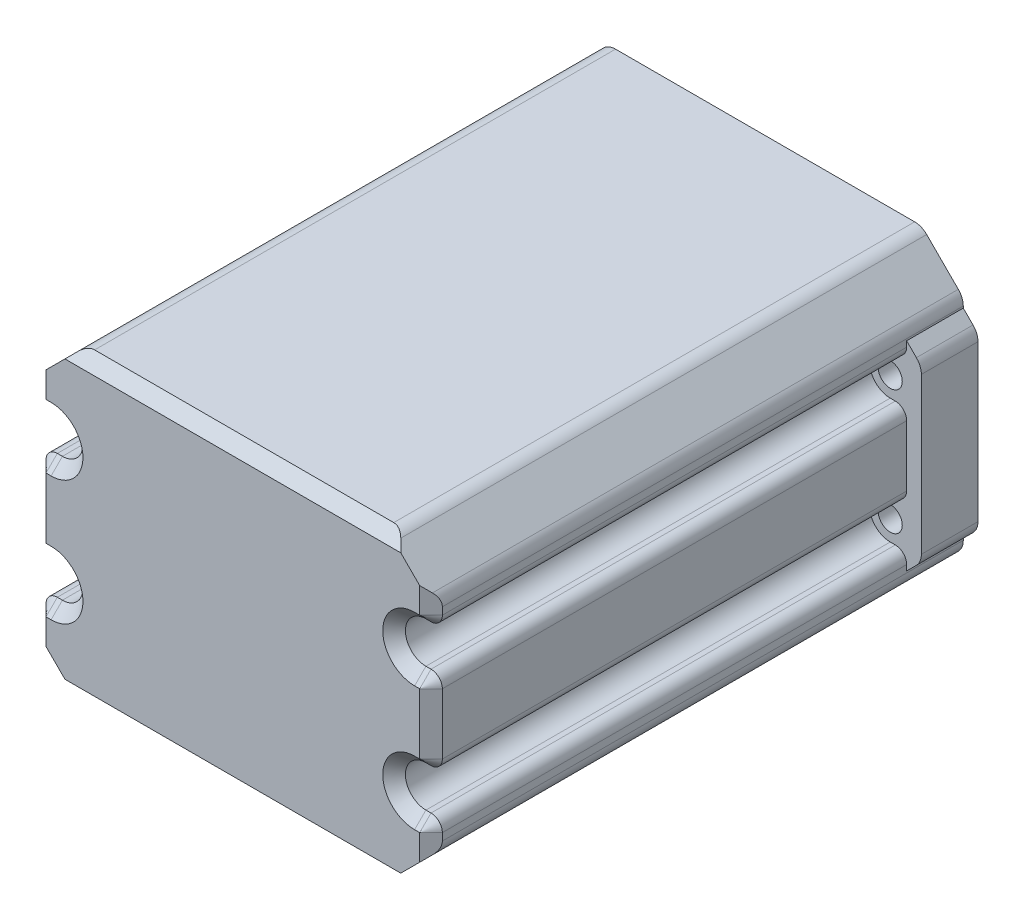
from build123d import *

# Parameters (mm, degrees)
BOSS_EXTRUDE1_DEPTH = 90
SKETCH1_3_R         = 2.125
BOSS_EXTRUDE2_DEPTH = 10
FILLET1_R           = 2
BOSS_EXTRUDE3_START = 4
BOSS_EXTRUDE3_DEPTH = 4
CHAMFER1_SIZE       = 2
FILLET3_R           = 3


with BuildPart() as part:
    # Sketch1 → Boss-Extrude1 (new body)
    with BuildSketch(Plane.XY):
        with BuildLine():
            Line((55.313708499, 53), (0, 53))
            Line((0, 53), (-7.343145751, 45.656854249))
            Line((-7.343145751, 45.656854249), (-7.343145751, 41.125))
            Line((-7.343145751, 41.125), (-4.443145751, 41.125))
            ThreePointArc((-4.443145751, 41.125), (-0.818145751, 37.5), (-4.443145751, 33.875))
            Line((-4.443145751, 33.875), (-7.343145751, 33.875))
            Line((-7.343145751, 33.875), (-7.343145751, 19.125))
            Line((-7.343145751, 19.125), (-4.443145751, 19.125))
            ThreePointArc((-4.443145751, 19.125), (-0.818145751, 15.5), (-4.443145751, 11.875))
            Line((-4.443145751, 11.875), (-7.343145751, 11.875))
            Line((-7.343145751, 11.875), (-7.343145751, 7.343145751))
            Line((-7.343145751, 7.343145751), (0, 0))
            Line((0, 0), (55.313708499, 0))
            Line((55.313708499, 0), (62.656854249, 7.343145751))
            Line((62.656854249, 7.343145751), (62.656854249, 11.875))
            Line((62.656854249, 11.875), (59.756854249, 11.875))
            ThreePointArc((59.756854249, 11.875), (56.131854249, 15.5), (59.756854249, 19.125))
            Line((59.756854249, 19.125), (62.656854249, 19.125))
            Line((62.656854249, 19.125), (62.656854249, 33.875))
            Line((62.656854249, 33.875), (59.756854249, 33.875))
            ThreePointArc((59.756854249, 33.875), (56.131854249, 37.5), (59.756854249, 41.125))
            Line((59.756854249, 41.125), (62.656854249, 41.125))
            Line((62.656854249, 41.125), (62.656854249, 45.656854249))
            Line((62.656854249, 45.656854249), (55.313708499, 53))
        make_face()
        with BuildLine():
            Line((53.656854249, 4), (1.656854249, 4))
            Line((1.656854249, 4), (-3.343145751, 9))
            Line((-3.343145751, 9), (-3.343145751, 9.601695159))
            ThreePointArc((-3.343145751, 9.601695159), (0.172046553, 11.665942097), (1.556854249, 15.5))
            Line((1.556854249, 15.5), (1.556854249, 37.5))
            ThreePointArc((1.556854249, 37.5), (0.172046553, 41.334057903), (-3.343145751, 43.398304841))
            Line((-3.343145751, 43.398304841), (-3.343145751, 44))
            Line((-3.343145751, 44), (1.656854249, 49))
            Line((1.656854249, 49), (53.656854249, 49))
            Line((53.656854249, 49), (58.656854249, 44))
            Line((58.656854249, 44), (58.656854249, 43.398304841))
            ThreePointArc((58.656854249, 43.398304841), (55.141661946, 41.334057903), (53.756854249, 37.5))
            Line((53.756854249, 37.5), (53.756854249, 15.5))
            ThreePointArc((53.756854249, 15.5), (55.141661946, 11.665942097), (58.656854249, 9.601695159))
            Line((58.656854249, 9.601695159), (58.656854249, 9))
            Line((58.656854249, 9), (53.656854249, 4))
        make_face(mode=Mode.SUBTRACT)
    extrude(amount=BOSS_EXTRUDE1_DEPTH)

    # Sketch1<3> → Boss-Extrude2 (add)
    # profile 1 of 2: a face of its own
    with BuildSketch(Plane.XY):
        with BuildLine():
            ThreePointArc((-4.443145751, 33.875), (-0.818145751, 37.5), (-4.443145751, 41.125))
            Line((-4.443145751, 41.125), (-7.343145751, 41.125))
            Line((-7.343145751, 41.125), (-7.343145751, 44.1))
            Line((-7.343145751, 44.1), (-9.943145751, 41.5))
            Line((-9.943145751, 41.5), (-9.943145751, 11.5))
            Line((-9.943145751, 11.5), (-7.343145751, 8.9))
            Line((-7.343145751, 8.9), (-7.343145751, 11.875))
            Line((-7.343145751, 11.875), (-4.443145751, 11.875))
            ThreePointArc((-4.443145751, 11.875), (-0.818145751, 15.5), (-4.443145751, 19.125))
            Line((-4.443145751, 19.125), (-7.343145751, 19.125))
            Line((-7.343145751, 19.125), (-7.343145751, 33.875))
            Line((-7.343145751, 33.875), (-4.443145751, 33.875))
        make_face()
        with Locations((-4.443145751, 15.5)):
            Circle(SKETCH1_3_R, mode=Mode.SUBTRACT)
        with Locations((-4.443145751, 37.5)):
            Circle(SKETCH1_3_R, mode=Mode.SUBTRACT)
    # profile 2 of 2: a face of its own
    with BuildSketch(Plane.XY):
        with BuildLine():
            Line((65.256854249, 41.5), (62.656854249, 44.1))
            Line((62.656854249, 44.1), (62.656854249, 41.125))
            Line((62.656854249, 41.125), (59.756854249, 41.125))
            ThreePointArc((59.756854249, 41.125), (56.131854249, 37.5), (59.756854249, 33.875))
            Line((59.756854249, 33.875), (62.656854249, 33.875))
            Line((62.656854249, 33.875), (62.656854249, 19.125))
            Line((62.656854249, 19.125), (59.756854249, 19.125))
            ThreePointArc((59.756854249, 19.125), (56.131854249, 15.5), (59.756854249, 11.875))
            Line((59.756854249, 11.875), (62.656854249, 11.875))
            Line((62.656854249, 11.875), (62.656854249, 8.9))
            Line((62.656854249, 8.9), (65.256854249, 11.5))
            Line((65.256854249, 11.5), (65.256854249, 41.5))
        make_face()
        with Locations((59.756854249, 37.5)):
            Circle(SKETCH1_3_R, mode=Mode.SUBTRACT)
        with Locations((59.756854249, 15.5)):
            Circle(SKETCH1_3_R, mode=Mode.SUBTRACT)
    extrude(amount=BOSS_EXTRUDE2_DEPTH)

    # Fillet1
    fillet1_edges = [part.edges().sort_by_distance(p)[0] for p in [
        (62.656854249, 41.125, 50),
        (62.656854249, 33.875, 50),
        (62.656854249, 19.125, 50),
        (62.656854249, 11.875, 50),
        (-7.343145751, 11.875, 50),
        (-7.343145751, 19.125, 50),
        (-7.343145751, 33.875, 50),
        (-7.343145751, 41.125, 50),
    ]]
    fillet(fillet1_edges, radius=FILLET1_R)

    # Sketch2 → Boss-Extrude3 (add)
    with BuildSketch(Plane.XY.offset(90).offset(BOSS_EXTRUDE3_START)):
        with BuildLine():
            Line((-7.343145751, 31.875), (-7.343145751, 21.125))
            ThreePointArc((-7.343145751, 21.125), (-6.757359313, 19.710786438), (-5.343145751, 19.125))
            Line((-5.343145751, 19.125), (-4.443145751, 19.125))
            ThreePointArc((-4.443145751, 19.125), (-0.818145751, 15.5), (-4.443145751, 11.875))
            Line((-4.443145751, 11.875), (-5.343145751, 11.875))
            ThreePointArc((-5.343145751, 11.875), (-6.757359313, 11.289213562), (-7.343145751, 9.875))
            Line((-7.343145751, 9.875), (-7.343145751, 7.343145751))
            Line((-7.343145751, 7.343145751), (0, 0))
            Line((0, 0), (55.313708499, 0))
            Line((55.313708499, 0), (62.656854249, 7.343145751))
            Line((62.656854249, 7.343145751), (62.656854249, 9.875))
            ThreePointArc((62.656854249, 9.875), (62.071067812, 11.289213562), (60.656854249, 11.875))
            Line((60.656854249, 11.875), (59.756854249, 11.875))
            ThreePointArc((59.756854249, 11.875), (56.131854249, 15.5), (59.756854249, 19.125))
            Line((59.756854249, 19.125), (60.656854249, 19.125))
            ThreePointArc((60.656854249, 19.125), (62.071067812, 19.710786438), (62.656854249, 21.125))
            Line((62.656854249, 21.125), (62.656854249, 31.875))
            ThreePointArc((62.656854249, 31.875), (62.071067812, 33.289213562), (60.656854249, 33.875))
            Line((60.656854249, 33.875), (59.756854249, 33.875))
            ThreePointArc((59.756854249, 33.875), (56.131854249, 37.5), (59.756854249, 41.125))
            Line((59.756854249, 41.125), (60.656854249, 41.125))
            ThreePointArc((60.656854249, 41.125), (62.071067812, 41.710786438), (62.656854249, 43.125))
            Line((62.656854249, 43.125), (62.656854249, 45.656854249))
            Line((62.656854249, 45.656854249), (55.313708499, 53))
            Line((55.313708499, 53), (0, 53))
            Line((0, 53), (-7.343145751, 45.656854249))
            Line((-7.343145751, 45.656854249), (-7.343145751, 43.125))
            ThreePointArc((-7.343145751, 43.125), (-6.757359313, 41.710786438), (-5.343145751, 41.125))
            Line((-5.343145751, 41.125), (-4.443145751, 41.125))
            ThreePointArc((-4.443145751, 41.125), (-0.818145751, 37.5), (-4.443145751, 33.875))
            Line((-4.443145751, 33.875), (-5.343145751, 33.875))
            ThreePointArc((-5.343145751, 33.875), (-6.757359313, 33.289213562), (-7.343145751, 31.875))
        make_face()
    extrude(amount=-BOSS_EXTRUDE3_DEPTH)

    # Chamfer1
    chamfer1_edges = [part.edges().sort_by_distance(p)[0] for p in [
        (-7.343145751, 44.390927125, 94),
        (-6.757359313, 41.710786438, 94),
        (-4.893145751, 41.125, 94),
        (-0.818145751, 37.5, 94),
        (-4.893145751, 33.875, 94),
        (-6.757359313, 33.289213562, 94),
        (-7.343145751, 26.5, 94),
        (-6.757359313, 19.710786438, 94),
        (-4.893145751, 19.125, 94),
        (-0.818145751, 15.5, 94),
        (-4.893145751, 11.875, 94),
        (-6.757359313, 11.289213562, 94),
        (-7.343145751, 8.609072875, 94),
        (27.656854249, 0, 94),
        (62.656854249, 8.609072875, 94),
        (62.071067812, 11.289213562, 94),
        (60.206854249, 11.875, 94),
        (56.131854249, 15.5, 94),
        (60.206854249, 19.125, 94),
        (62.071067812, 19.710786438, 94),
        (62.656854249, 26.5, 94),
        (62.071067812, 33.289213562, 94),
        (60.206854249, 33.875, 94),
        (56.131854249, 37.5, 94),
        (60.206854249, 41.125, 94),
        (62.071067812, 41.710786438, 94),
        (62.656854249, 44.390927125, 94),
        (27.656854249, 53, 94),
    ]]
    chamfer(chamfer1_edges, length=CHAMFER1_SIZE - 0.0001)  # a hair under: the kernel refuses the full size

    # Fillet3
    fillet3_edges = [part.edges().sort_by_distance(p)[0] for p in [
        (-9.943145751, 41.5, 5),
        (-9.943145751, 11.5, 5),
        (65.256854249, 11.5, 5),
        (65.256854249, 41.5, 5),
        (62.656854249, 7.343145751, 46.00005),
        (55.313708499, 0, 46.00005),
        (0, 0, 46.00005),
        (-7.343145751, 7.343145751, 46.00005),
        (55.313708499, 53, 46.00005),
        (62.656854249, 45.656854249, 46.00005),
        (-7.343145751, 45.656854249, 46.00005),
        (0, 53, 46.00005),
    ]]
    fillet(fillet3_edges, radius=FILLET3_R)


solid = part.part
